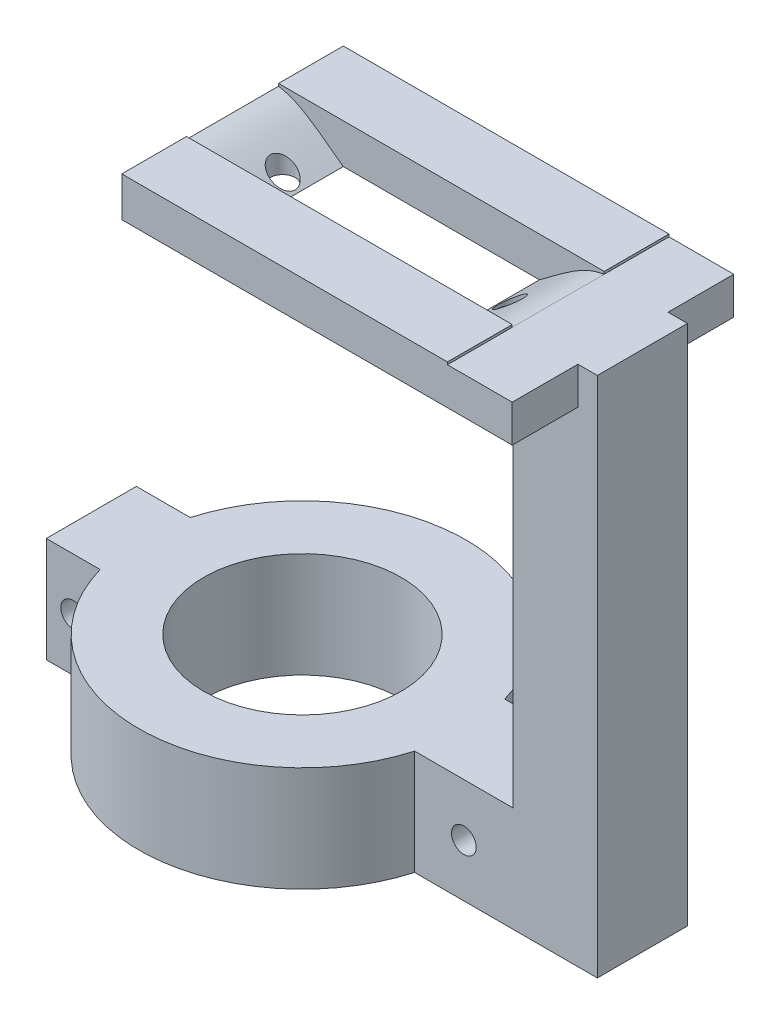
from build123d import *

# Parameters (mm, degrees)
SKETCH_1_W                = 50.28
SKETCH_1_H                = 34.2
SKETCH_1_W_2              = 30.28
SKETCH_1_H_2              = 14.2
EXTRUDE_1_DEPTH           = 12.25
SKETCH_4_W                = 13
SKETCH_4_H                = 13.91
EXTRUDE_1_2_DEPTH         = 74.82
SKETCH_5_W                = 13.91
SKETCH_5_H                = 16.23
EXTRUDE_2_DEPTH           = 16
SKETCH_7_R                = 25.25
SKETCH_7_R_2              = 15.25
EXTRUDE_2_2_DEPTH         = 16.23
SKETCH_15_R               = 1.91
CUT_EXTRUDE_6_DEPTH       = 97.964478439
SKETCH_18_W               = 49.344544624
SKETCH_18_H               = 6.125
CUT_EXTRUDE_8_DEPTH       = 101.789238284
SKETCH_19_W               = 34.2
SKETCH_19_H               = 6.125
CUT_EXTRUDE_9_DEPTH       = 10
SKETCH_21_R               = 1.91
CUT_EXTRUDE_10_DEPTH      = 10
SKETCH_20_R               = 1.91
CUT_EXTRUDE_11_DEPTH      = 10
FILLET_START              = -7.1
FILLET_1_DEPTH            = 14.2
FILLET_2_DEPTH            = 14.2
SKETCH_29_W               = 13.91
SKETCH_29_H               = 74.82
EXTRUDE_5_DEPTH           = 10
SKETCH_30_W               = 10
SKETCH_30_H               = 58.59
CUT_EXTRUDE_13_DEPTH      = 97.964478439
SKETCH_32_W               = 34.2
SKETCH_32_H               = 5.745736365
EXTRUDE_6_DEPTH           = 10
CUT_EXTRUDE_16_DEPTH      = 50
CUT_EXTRUDE_16_DEPTH_BACK = 50
SKETCH_38_W               = 116.985630298
SKETCH_38_H               = 80.538350638
SKETCH_41_W               = 13.91
SKETCH_41_H               = 5.745736365
EXTRUDE_7_DEPTH           = 3
SKETCH_42_W               = 13
SKETCH_42_H               = 13.91
EXTRUDE_8_DEPTH           = 74.82
SKETCH_43_W               = 13.91
SKETCH_43_H               = 16.23
EXTRUDE_9_DEPTH           = 15.22
SKETCH_44_R               = 1.91
CUT_EXTRUDE_17_DEPTH      = 15.22
SKETCH_46_R               = 25.25
SKETCH_46_R_2             = 15.25
EXTRUDE_6_2_DEPTH         = 16.23
EXTRUDE_10_DEPTH          = 7.22
EXTRUDE_10_DEPTH_BACK     = 10
SKETCH_47_W               = 13.91
SKETCH_47_H               = 16.23
SKETCH_50_W               = 3.056753925
SKETCH_50_H               = 16.23
CUT_EXTRUDE_18_DEPTH      = 96.578211037
SKETCH_51_R               = 1.91
CUT_EXTRUDE_19_DEPTH      = 95.015226304


with BuildPart() as part:
    # 草圖1 → Extrude 1 (new body)
    with BuildSketch(Plane(origin=(0, 0, 0), x_dir=(1, 0, 0), z_dir=(0, 1, 0))):
        Rectangle(SKETCH_1_W, SKETCH_1_H)
        Rectangle(SKETCH_1_W_2, SKETCH_1_H_2, mode=Mode.SUBTRACT)
    extrude(amount=EXTRUDE_1_DEPTH)

    # 草圖4 → Extrude 1 2 (add)
    with BuildSketch(Plane.XZ):
        with Locations((18.64, 0)):
            Rectangle(SKETCH_4_W, SKETCH_4_H)
    extrude(amount=EXTRUDE_1_2_DEPTH)

    # 草圖5 → Extrude 2 (add)
    with BuildSketch(Plane.ZY.offset(-12.14)):
        with Locations((0, -66.705)):
            Rectangle(SKETCH_5_W, SKETCH_5_H)
    extrude(amount=EXTRUDE_2_DEPTH)

    # 草圖7 → Extrude 2 2 (add)
    with BuildSketch(Plane(origin=(3.626674765, -74.82, 0), x_dir=(1, 0, 0), z_dir=(0, -1, 0))):
        with Locations((-30.978154344, 0)):
            Circle(SKETCH_7_R)
        with Locations((-30.978154344, 0)):
            Circle(SKETCH_7_R_2, mode=Mode.SUBTRACT)
    extrude(amount=-EXTRUDE_2_2_DEPTH)

    # 草圖15 → 除料-伸長6 (cut, through all)
    with BuildSketch(Plane(origin=(0, 0, -6.955), x_dir=(-1, 0, 0), z_dir=(0, 0, -1))):
        with Locations((-4.530883248, -66.705)):
            Circle(SKETCH_15_R)
    extrude(amount=-CUT_EXTRUDE_6_DEPTH, mode=Mode.SUBTRACT)

    # 草圖18 → 除料-伸長8 (cut, through all)
    with BuildSketch(Plane(origin=(0, 0, -17.1), x_dir=(-1, 0, 0), z_dir=(0, 0, -1))):
        with Locations((0.467727688, 9.1875)):
            Rectangle(SKETCH_18_W, SKETCH_18_H)
    extrude(amount=-CUT_EXTRUDE_8_DEPTH, mode=Mode.SUBTRACT)

    # 草圖19 → 除料-伸長9 (cut)
    with BuildSketch(Plane.ZY.offset(-24.204544624)):
        with Locations((0, 9.1875)):
            Rectangle(SKETCH_19_W, SKETCH_19_H)
    extrude(amount=-CUT_EXTRUDE_9_DEPTH, mode=Mode.SUBTRACT)

    # 草圖21 → 除料-伸長10 (cut)
    with BuildSketch(Plane(origin=(0, 6.125, 0), x_dir=(1, 0, 0), z_dir=(0, 1, 0))):
        with Locations(Location((17.69, 0, 0), (0, 0, 270))):
            Circle(SKETCH_21_R)
    extrude(amount=-CUT_EXTRUDE_10_DEPTH, mode=Mode.SUBTRACT)

    # 草圖20 → 除料-伸長11 (cut)
    with BuildSketch(Plane(origin=(0, 6.125, 0), x_dir=(1, 0, 0), z_dir=(0, 1, 0))):
        with Locations(Location((-17.395, 0, 0), (0, 0, 270))):
            Circle(SKETCH_20_R)
    extrude(amount=-CUT_EXTRUDE_11_DEPTH, mode=Mode.SUBTRACT)

    # 圓角1: read off the stored shape, not the designer's step
    # 圓角1 outline → 圓角1 (cut)
    with BuildSketch(Plane.XY.offset(FILLET_START)):
        with BuildLine():
            add(Edge.make_bspline(
                [(-15.14, 0), (-21.974170252, 5.199829476), (-25.14, 5.745736365)],
                knots=[0, 0, 0, 0.664102345, 0.664102345, 0.664102345], degree=2, weights=[1, 2.223777218, 1.822127795]))
            Line((-15.14, 0), (-15.14, 6.125))
            Line((-15.14, 6.125), (-25.14, 6.125))
            Line((-25.14, 6.125), (-25.14, 5.745736365))
        make_face()
    extrude(amount=FILLET_1_DEPTH, mode=Mode.SUBTRACT)

    # 圓角2: read off the stored shape, not the designer's step
    # 圓角2 outline → 圓角2 (cut)
    with BuildSketch(Plane.XY.offset(FILLET_START)):
        with BuildLine():
            Line((15.14, 6.125), (15.14, 0))
            add(Edge.make_bspline(
                [(15.14, 0), (21.974170252, 5.199829476), (25.14, 5.745736365)],
                knots=[0, 0, 0, 0.664102345, 0.664102345, 0.664102345], degree=2, weights=[1, 2.223777218, 1.822127795]))
            Line((25.14, 5.745736365), (25.14, 6.125))
            Line((25.14, 6.125), (15.14, 6.125))
        make_face()
    extrude(amount=FILLET_2_DEPTH, mode=Mode.SUBTRACT)

    # 草圖29 → 填料-伸長5 (add)
    with BuildSketch(Plane(origin=(25.14, 0, 0), x_dir=(0, 0, -1), z_dir=(1, 0, 0))):
        with Locations((0, -37.41)):
            Rectangle(SKETCH_29_W, SKETCH_29_H)
    extrude(amount=EXTRUDE_5_DEPTH)

    # 草圖30 → 除料-伸長13 (cut, through all)
    with BuildSketch(Plane.XY.offset(6.955)):
        with Locations((17.14, -29.295)):
            Rectangle(SKETCH_30_W, SKETCH_30_H)
    extrude(amount=-CUT_EXTRUDE_13_DEPTH, mode=Mode.SUBTRACT)

    # 草圖32 → Extrude 6 (add)
    with BuildSketch(Plane(origin=(25.14, 0, 0), x_dir=(0, 0, -1), z_dir=(1, 0, 0))):
        with Locations((0, 2.872868182)):
            Rectangle(SKETCH_32_W, SKETCH_32_H)
    extrude(amount=EXTRUDE_6_DEPTH)

    # 草圖38 → 除料-伸長16 (cut, two sides: drawn at the far end of the back side and taken through both)
    with BuildSketch(Plane(origin=(0, 0, -6.955), x_dir=(-1, 0, 0), z_dir=(0, 0, -1)).offset(-CUT_EXTRUDE_16_DEPTH_BACK)):
        with Locations((7.268869252, -40.269175319)):
            Rectangle(SKETCH_38_W, SKETCH_38_H)
    extrude(amount=CUT_EXTRUDE_16_DEPTH + CUT_EXTRUDE_16_DEPTH_BACK, mode=Mode.SUBTRACT)

    # 草圖41 → 填料-伸長7 (add)
    with BuildSketch(Plane(origin=(35.14, 0, 0), x_dir=(0, 0, -1), z_dir=(1, 0, 0))):
        with Locations((0, 2.872868182)):
            Rectangle(SKETCH_41_W, SKETCH_41_H)
    extrude(amount=EXTRUDE_7_DEPTH)

    # 草圖42 → 填料-伸長8 (add)
    with BuildSketch(Plane(origin=(0, 0, 0), x_dir=(-1, 0, 0), z_dir=(0, -1, 0))):
        with Locations((-31.64, 0)):
            Rectangle(SKETCH_42_W, SKETCH_42_H)
    extrude(amount=EXTRUDE_8_DEPTH)

    # 草圖43 → 填料-伸長9 (add)
    with BuildSketch(Plane.ZY.offset(-25.14)):
        with Locations((0, -66.705)):
            Rectangle(SKETCH_43_W, SKETCH_43_H)
    extrude(amount=EXTRUDE_9_DEPTH)

    # 草圖44 → 除料-伸長17 (cut)
    with BuildSketch(Plane(origin=(0, 0, -6.955), x_dir=(-1, 0, 0), z_dir=(0, 0, -1))):
        with Locations(Location((-17.524895264, -66.705, 0), (0, 0, 90))):
            Circle(SKETCH_44_R)
    extrude(amount=-CUT_EXTRUDE_17_DEPTH, mode=Mode.SUBTRACT)

    # 草圖46 → Extrude 6 2 (add)
    with BuildSketch(Plane(origin=(0, -58.59, 0), x_dir=(1, 0, 0), z_dir=(0, 1, 0))):
        with Locations((-14.35, 0)):
            Circle(SKETCH_46_R)
        with Locations((-14.35, 0)):
            Circle(SKETCH_46_R_2, mode=Mode.SUBTRACT)
    extrude(amount=-EXTRUDE_6_2_DEPTH)

    # 草圖47 → 填料-伸長10 (add, two sides: drawn at the far end of the back side and taken through both)
    with BuildSketch(Plane(origin=(-40, 0, 0), x_dir=(0, 0, -1), z_dir=(1, 0, 0)).offset(-EXTRUDE_10_DEPTH_BACK)):
        with Locations((0, -66.705)):
            Rectangle(SKETCH_47_W, SKETCH_47_H)
    extrude(amount=EXTRUDE_10_DEPTH + EXTRUDE_10_DEPTH_BACK)

    # 草圖50 → 除料-伸長18 (cut, through all)
    with BuildSketch(Plane(origin=(0, 0, -6.955), x_dir=(-1, 0, 0), z_dir=(0, 0, -1))):
        with Locations((48.471623038, -66.705)):
            Rectangle(SKETCH_50_W, SKETCH_50_H)
    extrude(amount=-CUT_EXTRUDE_18_DEPTH, mode=Mode.SUBTRACT)

    # 草圖51 → 除料-伸長19 (cut, through all)
    with BuildSketch(Plane(origin=(0, 0, -6.955), x_dir=(-1, 0, 0), z_dir=(0, 0, -1))):
        with Locations((42.786508152, -66.705)):
            Circle(SKETCH_51_R)
    extrude(amount=-CUT_EXTRUDE_19_DEPTH, mode=Mode.SUBTRACT)


solid = part.part
